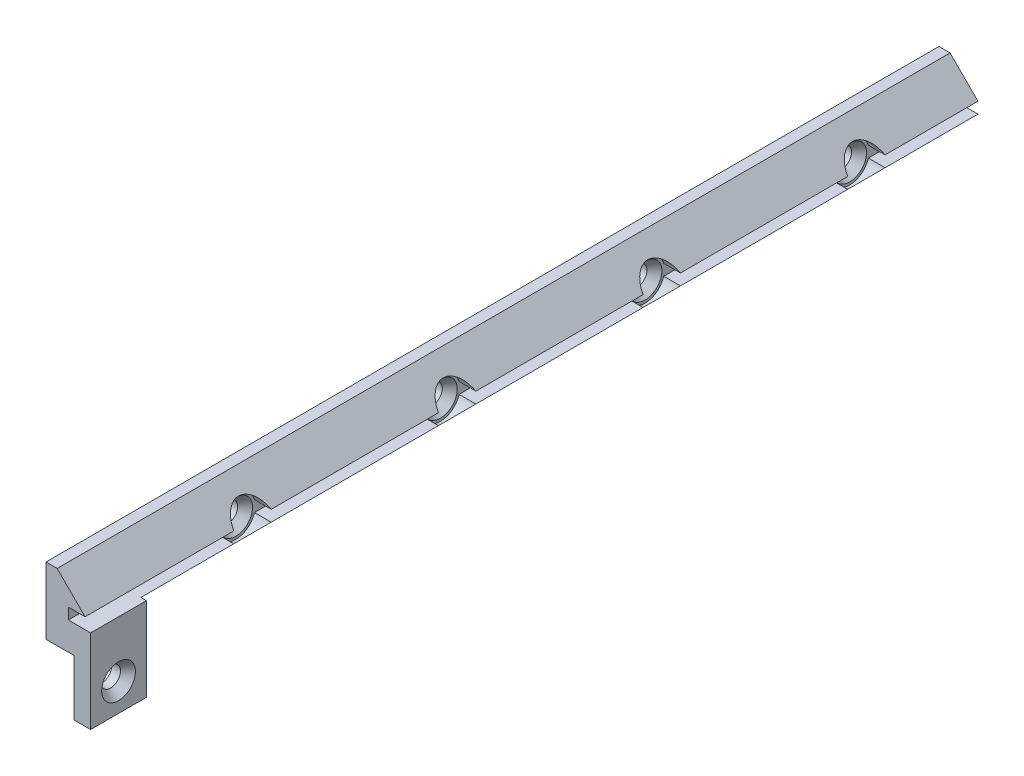
from build123d import *

# Parameters (mm, degrees)
BOSS_EXTRUDE1_DEPTH                            = 75
SKETCH5_R                                      = 1.75
CUT_EXTRUDE1_DEPTH                             = 2
CSK_FOR_0_FLAT_HEAD_MACHINE_SCREW2_D           = 1.778
CSK_FOR_0_FLAT_HEAD_MACHINE_SCREW2_DEPTH       = 3.302
CSK_FOR_0_FLAT_HEAD_MACHINE_SCREW2_CSINK_D     = 3.0226
CSK_FOR_0_FLAT_HEAD_MACHINE_SCREW2_CSINK_ANGLE = 82
CSK_FOR_0_FLAT_HEAD_MACHINE_SCREW2_TIP         = 0.53416509
CHAMFER1_SIZE                                  = 3
SKETCH6_W                                      = 1.5
SKETCH6_H                                      = 5
BOSS_EXTRUDE2_DEPTH                            = 5
CSK_FOR_0_FLAT_HEAD_MACHINE_SCREW1_D           = 1.778
CSK_FOR_0_FLAT_HEAD_MACHINE_SCREW1_DEPTH       = 3.302
CSK_FOR_0_FLAT_HEAD_MACHINE_SCREW1_CSINK_D     = 3.0226
CSK_FOR_0_FLAT_HEAD_MACHINE_SCREW1_CSINK_ANGLE = 82
CSK_FOR_0_FLAT_HEAD_MACHINE_SCREW1_TIP         = 0.53416509


with BuildPart() as part:
    # Sketch1 → Boss-Extrude1 (new body)
    with BuildSketch(Plane.XY):
        Polygon((-2, -3), (2, -3), (2, -0.5), (0, -0.5), (0, 0.5), (2, 0.5), (2, 3), (-2, 3), align=None)
    extrude(amount=BOSS_EXTRUDE1_DEPTH)

    # Sketch5 → Cut-Extrude1 (cut)
    with BuildSketch(Plane(origin=(2, 0, 0), x_dir=(0, 0, -1), z_dir=(1, 0, 0))):
        with Locations((-65, 0)):
            Circle(SKETCH5_R)
        with Locations((-46.66667, 0)):
            Circle(SKETCH5_R)
        with Locations((-28.33334, 0)):
            Circle(SKETCH5_R)
        with Locations((-10.00001, 0)):
            Circle(SKETCH5_R)
    extrude(amount=-CUT_EXTRUDE1_DEPTH, mode=Mode.SUBTRACT)

    # CSK for #0 Flat Head Machine Screw2
    with Locations(Plane(origin=(0, 0, 0), x_dir=(0, 0, -1), z_dir=(1, 0, 0))):
        with Locations((-65, 0), (-10.00001, 0), (-46.66667, 0), (-28.33334, 0)):
            CounterSinkHole(CSK_FOR_0_FLAT_HEAD_MACHINE_SCREW2_D / 2, CSK_FOR_0_FLAT_HEAD_MACHINE_SCREW2_CSINK_D / 2, depth=CSK_FOR_0_FLAT_HEAD_MACHINE_SCREW2_DEPTH, counter_sink_angle=CSK_FOR_0_FLAT_HEAD_MACHINE_SCREW2_CSINK_ANGLE)
            with Locations((0, 0, -(CSK_FOR_0_FLAT_HEAD_MACHINE_SCREW2_DEPTH + CSK_FOR_0_FLAT_HEAD_MACHINE_SCREW2_TIP / 2))):  # 118° drill point
                Cone(0, CSK_FOR_0_FLAT_HEAD_MACHINE_SCREW2_D / 2, CSK_FOR_0_FLAT_HEAD_MACHINE_SCREW2_TIP, mode=Mode.SUBTRACT)

    # Chamfer1
    # the kernel refuses this chamfer: 3 mm, written as the material it takes off along each edge
    with BuildSketch(Plane(origin=(2, -3, -7.715048964), x_dir=(-0.9996219169112968, -0.027495876610586348, 0), z_dir=(0, 0, 1))) as chamfer1_piece_1:
        Polygon((CHAMFER1_SIZE * 0.999621916911, -CHAMFER1_SIZE * 0.0274958766106), (-CHAMFER1_SIZE * 0.0274958766106, -CHAMFER1_SIZE * 0.999621916911), (0, 0), align=None)
    extrude(amount=90.430097928, mode=Mode.SUBTRACT)
    with BuildSketch(Plane(origin=(2, 3, -7.715048964), x_dir=(-0.9996219169112968, 0.027495876610586348, 0), z_dir=(0, 0, 1))) as chamfer1_piece_2:
        Polygon((CHAMFER1_SIZE * 0.999621916911, CHAMFER1_SIZE * 0.0274958766106), (-CHAMFER1_SIZE * 0.0274958766106, CHAMFER1_SIZE * 0.999621916911), (0, 0), align=None)
    extrude(amount=90.430097928, mode=Mode.SUBTRACT)

    # Sketch6 → Boss-Extrude2 (add)
    with BuildSketch(Plane.XY.offset(75)):
        Polygon((-2, 3), (-2, -3), (-1, -3), (1.5, -0.5), (0, -0.5), (0, 0.5), (1.5, 0.5), (-1, 3), align=None)
        Polygon((1.5, -0.5), (-1, -3), (0.5, -3), (2, -3), (2, -0.5), align=None)
        with Locations((1.25, -5.5)):
            Rectangle(SKETCH6_W, SKETCH6_H)
    extrude(amount=BOSS_EXTRUDE2_DEPTH)

    # CSK for #0 Flat Head Machine Screw1
    with Locations(Plane(origin=(2, 0, 0), x_dir=(0, 0, -1), z_dir=(1, 0, 0))):
        with Locations((-77.5, -5.5)):
            CounterSinkHole(CSK_FOR_0_FLAT_HEAD_MACHINE_SCREW1_D / 2, CSK_FOR_0_FLAT_HEAD_MACHINE_SCREW1_CSINK_D / 2, depth=CSK_FOR_0_FLAT_HEAD_MACHINE_SCREW1_DEPTH, counter_sink_angle=CSK_FOR_0_FLAT_HEAD_MACHINE_SCREW1_CSINK_ANGLE)
            with Locations((0, 0, -(CSK_FOR_0_FLAT_HEAD_MACHINE_SCREW1_DEPTH + CSK_FOR_0_FLAT_HEAD_MACHINE_SCREW1_TIP / 2))):  # 118° drill point
                Cone(0, CSK_FOR_0_FLAT_HEAD_MACHINE_SCREW1_D / 2, CSK_FOR_0_FLAT_HEAD_MACHINE_SCREW1_TIP, mode=Mode.SUBTRACT)


solid = part.part
